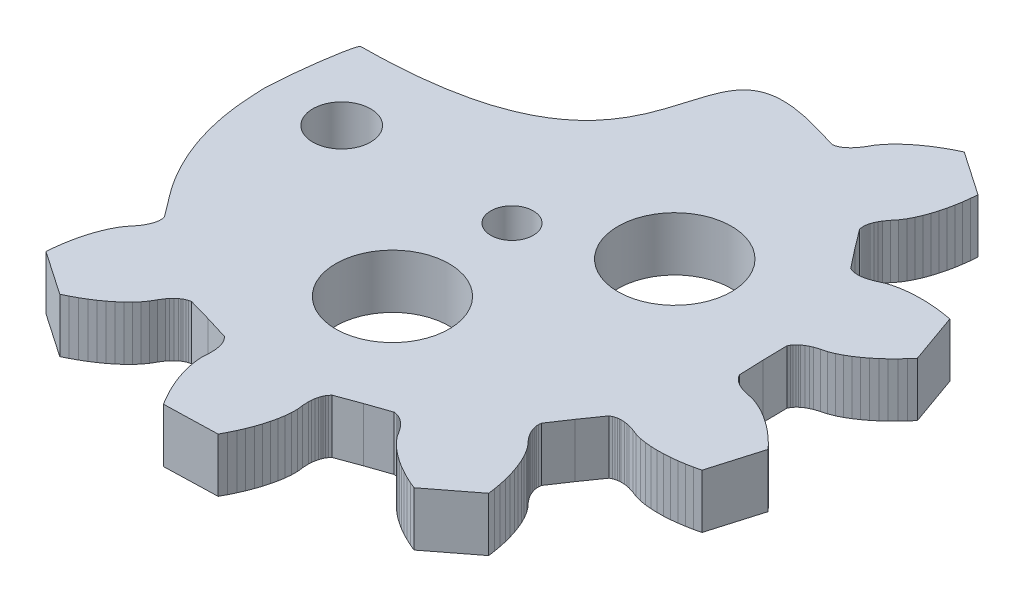
from build123d import *

# Parameters (mm, degrees)
SKETCH1_R           = 1.700000029
SKETCH1_R_2         = 3.33313127
SKETCH1_R_3         = 1.25
SKETCH1_R_4         = 3.337393761
BOSS_EXTRUDE1_DEPTH = 3.175


with BuildPart() as part:
    # Sketch1 → Boss-Extrude1 (new body)
    with BuildSketch(Plane(origin=(0, 0, 0), x_dir=(1, 0, 0), z_dir=(0, 1, 0))):
        with BuildLine():
            Line((11.914200973, 1.674742522), (11.889170094, 3.102731375))
            Line((11.889170094, 3.102731375), (11.9570847, 3.237670669))
            Line((11.9570847, 3.237670669), (12.028696835, 3.33919311))
            Line((12.028696835, 3.33919311), (12.102655529, 3.422833079))
            Line((12.102655529, 3.422833079), (12.178035724, 3.494286875))
            Line((12.178035724, 3.494286875), (12.254270446, 3.556913579))
            Line((12.254270446, 3.556913579), (12.409653424, 3.662914792))
            Line((12.409653424, 3.662914792), (12.567882114, 3.749402911))
            Line((12.567882114, 3.749402911), (12.728386832, 3.820650162))
            Line((12.728386832, 3.820650162), (13.055155513, 3.928510282))
            Line((13.055155513, 3.928510282), (13.385339592, 4.013509101))
            Line((13.385339592, 4.013509101), (13.708266968, 4.141175827))
            Line((13.708266968, 4.141175827), (14.025152969, 4.300117856))
            Line((14.025152969, 4.300117856), (14.336561854, 4.484486697))
            Line((14.336561854, 4.484486697), (14.642778466, 4.690879788))
            Line((14.642778466, 4.690879788), (14.943591207, 4.91743822))
            Line((14.943591207, 4.91743822), (15.23864199, 5.162585728))
            Line((15.23864199, 5.162585728), (15.528147838, 5.425963575))
            Line((15.528147838, 5.425963575), (15.811180978, 5.706017235))
            Line((15.811180978, 5.706017235), (16.087958432, 6.00288803))
            Line((16.087958432, 6.00288803), (16.357834558, 6.315717165))
            Line((16.357834558, 6.315717165), (15.309046935, 9.268597221))
            Line((15.309046935, 9.268597221), (14.902842443, 9.340333659))
            Line((14.902842443, 9.340333659), (14.500905165, 9.395263833))
            Line((14.500905165, 9.395263833), (14.104800377, 9.433376873))
            Line((14.104800377, 9.433376873), (13.714525367, 9.454401008))
            Line((13.714525367, 9.454401008), (13.330866843, 9.457673121))
            Line((13.330866843, 9.457673121), (12.954956036, 9.442714894))
            Line((12.954956036, 9.442714894), (12.587438591, 9.408939305))
            Line((12.587438591, 9.408939305), (12.229665474, 9.354867924))
            Line((12.229665474, 9.354867924), (11.883695691, 9.277717826))
            Line((11.883695691, 9.277717826), (11.553156237, 9.172488441))
            Line((11.553156237, 9.172488441), (11.24331263, 9.02908079))
            Line((11.24331263, 9.02908079), (10.922162129, 8.906110252))
            Line((10.922162129, 8.906110252), (10.752623832, 8.859876721))
            Line((10.752623832, 8.859876721), (10.57562266, 8.82674251))
            Line((10.57562266, 8.82674251), (10.388378007, 8.810577624))
            Line((10.388378007, 8.810577624), (10.289602743, 8.810784169))
            Line((10.289602743, 8.810784169), (10.186202178, 8.818698115))
            Line((10.186202178, 8.818698115), (10.076331618, 8.836863229))
            Line((10.076331618, 8.836863229), (9.956572951, 8.869986569))
            Line((9.956572951, 8.869986569), (9.81889633, 8.931547934))
            Line((9.81889633, 8.931547934), (8.937794171, 10.054404181))
            Line((8.937794171, 10.054404181), (8.079446863, 11.195218997))
            Line((8.079446863, 11.195218997), (8.055482109, 11.344681686))
            Line((8.055482109, 11.344681686), (8.053846299, 11.468858883))
            Line((8.053846299, 11.468858883), (8.064727285, 11.579925891))
            Line((8.064727285, 11.579925891), (8.083499766, 11.681872293))
            Line((8.083499766, 11.681872293), (8.108674424, 11.777839754))
            Line((8.108674424, 11.777839754), (8.171966442, 11.954946898))
            Line((8.171966442, 11.954946898), (8.249411067, 12.118095929))
            Line((8.249411067, 12.118095929), (8.337308058, 12.270200222))
            Line((8.337308058, 12.270200222), (8.538488295, 12.549895146))
            Line((8.538488295, 12.549895146), (8.755741791, 12.813218639))
            Line((8.755741791, 12.813218639), (8.942202449, 13.10666513))
            Line((8.942202449, 13.10666513), (9.105124259, 13.421918455))
            Line((9.105124259, 13.421918455), (9.248847681, 13.75433678))
            Line((9.248847681, 13.75433678), (9.375429005, 14.101637236))
            Line((9.375429005, 14.101637236), (9.485869251, 14.461917432))
            Line((9.485869251, 14.461917432), (9.580808635, 14.834307704))
            Line((9.580808635, 14.834307704), (9.66066764, 15.217590522))
            Line((9.66066764, 15.217590522), (9.725169562, 15.610994059))
            Line((9.725169562, 15.610994059), (9.774949191, 16.014083482))
            Line((9.774949191, 16.014083482), (9.809653867, 16.426086965))
            Line((9.809653867, 16.426086965), (7.228782167, 18.19739756))
            Line((7.228782167, 18.19739756), (6.857849324, 18.016224736))
            Line((6.857849324, 18.016224736), (6.50064318, 17.823941949))
            Line((6.50064318, 17.823941949), (6.157730707, 17.62161454))
            Line((6.157730707, 17.62161454), (5.829754835, 17.408525034))
            Line((5.829754835, 17.408525034), (5.517561955, 17.185608321))
            Line((5.517561955, 17.185608321), (5.221800422, 16.952146927))
            Line((5.221800422, 16.952146927), (4.944455995, 16.708423495))
            Line((4.944455995, 16.708423495), (4.687020708, 16.453937966))
            Line((4.687020708, 16.453937966), (4.452345698, 16.187777194))
            Line((4.452345698, 16.187777194), (4.246328563, 15.907864854))
            Line((4.246328563, 15.907864854), (4.0800646, 15.609569984))
            Line((4.0800646, 15.609569984), (3.892394039, 15.321037096))
            Line((3.892394039, 15.321037096), (3.782520766, 15.183684484))
            Line((3.782520766, 15.183684484), (3.658711909, 15.052593455))
            Line((3.658711909, 15.052593455), (3.516412701, 14.929198955))
            Line((3.516412701, 14.929198955), (3.436409918, 14.87127931))
            Line((3.436409918, 14.87127931), (3.348298617, 14.816773097))
            Line((3.348298617, 14.816773097), (3.248739357, 14.766691301))
            Line((3.248739357, 14.766691301), (3.132610399, 14.723023281))
            Line((3.132610399, 14.723023281), (2.985048385, 14.691747977))
            Line((2.985048385, 14.691747977), (1.613045831, 15.081520665))
            add(Edge.make_bspline(
                [(1.613045831, 15.081520665), (-7.729706306, 17.786187647), (2.333928114, 5.898093477), (-15.890831097, 5.824780774)],
                knots=[86, 86, 86, 86, 87, 87, 87, 87], degree=3))
            add(Edge.make_bspline(
                [(-15.890831097, 5.824780774), (-16.087958431, 5.803984925), (-16.532063261, 2.803447263), (-16.607446169, 0.877037468)],
                knots=[87, 87, 87, 87, 88, 88, 88, 88], degree=3))
            Line((-16.607446169, 0.877037468), (-16.567551933, 0.129626189))
            add(Edge.make_bspline(
                [(-16.567551933, 0.129626189), (-16.408040095, -3.82164484), (-14.671010433, -6.429208362), (-13.830225705, -7.50220023)],
                knots=[89, 89, 89, 89, 90, 90, 90, 90], degree=3))
            Line((-13.830225705, -7.50220023), (-12.971878397, -8.643009611))
            Line((-12.971878397, -8.643009611), (-12.947913643, -8.792195093))
            Line((-12.947913643, -8.792195093), (-12.946492143, -8.916654932))
            Line((-12.946492143, -8.916654932), (-12.956947221, -9.027509959))
            Line((-12.956947221, -9.027509959), (-12.976148323, -9.129668342))
            Line((-12.976148323, -9.129668342), (-13.001111383, -9.225635803))
            Line((-13.001111383, -9.225635803), (-13.064400689, -9.402742946))
            Line((-13.064400689, -9.402742946), (-13.141986379, -9.565891977))
            Line((-13.141986379, -9.565891977), (-13.229880657, -9.718137591))
            Line((-13.229880657, -9.718137591), (-13.430708232, -9.99762597))
            Line((-13.430708232, -9.99762597), (-13.648176038, -10.261009252))
            Line((-13.648176038, -10.261009252), (-13.834425098, -10.554243763))
            Line((-13.834425098, -10.554243763), (-13.997344196, -10.869638408))
            Line((-13.997344196, -10.869638408), (-14.141279215, -11.202056733))
            Line((-14.141279215, -11.202056733), (-14.267863252, -11.549221304))
            Line((-14.267863252, -11.549221304), (-14.378306211, -11.90971348))
            Line((-14.378306211, -11.90971348), (-14.473242882, -12.281886336))
            Line((-14.473242882, -12.281886336), (-14.55289029, -12.665169155))
            Line((-14.55289029, -12.665169155), (-14.617601096, -13.058790108))
            Line((-14.617601096, -13.058790108), (-14.667169128, -13.461879531))
            Line((-14.667169128, -13.461879531), (-14.702299712, -13.873877579))
            Line((-14.702299712, -13.873877579), (-12.121213701, -15.645117513))
            Line((-12.121213701, -15.645117513), (-11.750283571, -15.463808804))
            Line((-11.750283571, -15.463808804), (-11.393080139, -15.271737998))
            Line((-11.393080139, -15.271737998), (-11.050167666, -15.069193172))
            Line((-11.050167666, -15.069193172), (-10.722186369, -14.856533063))
            Line((-10.722186369, -14.856533063), (-10.409781892, -14.633398934))
            Line((-10.409781892, -14.633398934), (-10.114446266, -14.399937541))
            Line((-10.114446266, -14.399937541), (-9.836890242, -14.156214108))
            Line((-9.836890242, -14.156214108), (-9.579457668, -13.901734015))
            Line((-9.579457668, -13.901734015), (-9.344568348, -13.635785223))
            Line((-9.344568348, -13.635785223), (-9.13897712, -13.355443486))
            Line((-9.13897712, -13.355443486), (-8.972281824, -13.057366032))
            Line((-8.972281824, -13.057366032), (-8.784828286, -12.768827709))
            Line((-8.784828286, -12.768827709), (-8.674955013, -12.631475097))
            Line((-8.674955013, -12.631475097), (-8.550931846, -12.500384068))
            Line((-8.550931846, -12.500384068), (-8.409058545, -12.376995004))
            Line((-8.409058545, -12.376995004), (-8.328841452, -12.319075358))
            Line((-8.328841452, -12.319075358), (-8.240518554, -12.264503921))
            Line((-8.240518554, -12.264503921), (-8.141170891, -12.21441669))
            Line((-8.141170891, -12.21441669), (-8.024830336, -12.17103131))
            Line((-8.024830336, -12.17103131), (-7.877482631, -12.13953859))
            Line((-7.877482631, -12.13953859), (-6.505480077, -12.529099297))
            Line((-6.505480077, -12.529099297), (-5.141794926, -12.946934967))
            Line((-5.141794926, -12.946934967), (-5.034911144, -13.053159031))
            Line((-5.034911144, -13.053159031), (-4.960597074, -13.152898661))
            Line((-4.960597074, -13.152898661), (-4.904133139, -13.249007442))
            Line((-4.904133139, -13.249007442), (-4.859545782, -13.342904014))
            Line((-4.859545782, -13.342904014), (-4.823487426, -13.43523519))
            Line((-4.823487426, -13.43523519), (-4.771076393, -13.615766637))
            Line((-4.771076393, -13.615766637), (-4.738007527, -13.793444498))
            Line((-4.738007527, -13.793444498), (-4.719875263, -13.968344869))
            Line((-4.719875263, -13.968344869), (-4.718453763, -14.312661289))
            Line((-4.718453763, -14.312661289), (-4.739857648, -14.653776257))
            Line((-4.739857648, -14.653776257), (-4.718453763, -15.000728847))
            Line((-4.718453763, -15.000728847), (-4.665261448, -15.351883003))
            Line((-4.665261448, -15.351883003), (-4.586606921, -15.705532009))
            Line((-4.586606921, -15.705532009), (-4.485197541, -16.060963826))
            Line((-4.485197541, -16.060963826), (-4.363236092, -16.417607738))
            Line((-4.363236092, -16.417607738), (-4.221579813, -16.774816932))
            Line((-4.221579813, -16.774816932), (-4.061075095, -17.131890241))
            Line((-4.061075095, -17.131890241), (-3.882508646, -17.488316737))
            Line((-3.882508646, -17.488316737), (-3.686162595, -17.843531139))
            Line((-3.686162595, -17.843531139), (-3.472677159, -18.19739756))
            Line((-3.472677159, -18.19739756), (-0.345292944, -18.110550705))
            Line((-0.345292944, -18.110550705), (-0.151792605, -17.745644981))
            Line((-0.151792605, -17.745644981), (0.024571062, -17.3798859))
            Line((0.024571062, -17.3798859), (0.183225659, -17.013980062))
            Line((0.183225659, -17.013980062), (0.323747993, -16.648644942))
            Line((0.323747993, -16.648644942), (0.445495132, -16.284309936))
            Line((0.445495132, -16.284309936), (0.547685794, -15.921399005))
            Line((0.547685794, -15.921399005), (0.628969012, -15.560912264))
            Line((0.628969012, -15.560912264), (0.688208128, -15.203273673))
            Line((0.688208128, -15.203273673), (0.721843966, -14.849907308))
            Line((0.721843966, -14.849907308), (0.724119994, -14.502095925))
            Line((0.724119994, -14.502095925), (0.683797138, -14.162839864))
            Line((0.683797138, -14.162839864), (0.666231846, -13.818952841))
            Line((0.666231846, -13.818952841), (0.674695739, -13.643052356))
            Line((0.674695739, -13.643052356), (0.697879212, -13.46409174))
            Line((0.697879212, -13.46409174), (0.74019054, -13.280494727))
            Line((0.74019054, -13.280494727), (0.771268221, -13.186598154))
            Line((0.771268221, -13.186598154), (0.810595485, -13.090489374))
            Line((0.810595485, -13.090489374), (0.861582305, -12.991320461))
            Line((0.861582305, -12.991320461), (0.930137129, -12.887732567))
            Line((0.930137129, -12.887732567), (1.031117888, -12.775453465))
            Line((1.031117888, -12.775453465), (2.369628382, -12.283092997))
            Line((2.369628382, -12.283092997), (3.717807246, -11.817806266))
            Line((3.717807246, -11.817806266), (3.866793473, -11.84103174))
            Line((3.866793473, -11.84103174), (3.985268992, -11.8777968))
            Line((3.985268992, -11.8777968), (4.087530187, -11.922464935))
            Line((4.087530187, -11.922464935), (4.178628266, -11.972122769))
            Line((4.178628266, -11.972122769), (4.261902669, -12.025411451))
            Line((4.261902669, -12.025411451), (4.410460275, -12.140750685))
            Line((4.410460275, -12.140750685), (4.54123828, -12.264927883))
            Line((4.54123828, -12.264927883), (4.658577142, -12.395801496))
            Line((4.658577142, -12.395801496), (4.861962874, -12.673507062))
            Line((4.861962874, -12.673507062), (5.044582226, -12.961827969))
            Line((5.044582226, -12.961827969), (5.265535962, -13.230271611))
            Line((5.265535962, -13.230271611), (5.514504644, -13.482898232))
            Line((5.514504644, -13.482898232), (5.785804982, -13.722632079))
            Line((5.785804982, -13.722632079), (6.076306423, -13.950609152))
            Line((6.076306423, -13.950609152), (6.384373155, -14.167258846))
            Line((6.384373155, -14.167258846), (6.708510433, -14.372651823))
            Line((6.708510433, -14.372651823), (7.047725378, -14.567141383))
            Line((7.047725378, -14.567141383), (7.401304527, -14.750309))
            Line((7.401304527, -14.750309), (7.768393352, -14.922361219))
            Line((7.768393352, -14.922361219), (8.148782969, -15.082727324))
            Line((8.148782969, -15.082727324), (10.627889914, -13.171069211))
            Line((10.627889914, -13.171069211), (10.570430386, -12.761489917))
            Line((10.570430386, -12.761489917), (10.498462877, -12.361890022))
            Line((10.498462877, -12.361890022), (10.412345474, -11.97247607))
            Line((10.412345474, -11.97247607), (10.311576312, -11.594248176))
            Line((10.311576312, -11.594248176), (10.196087571, -11.227700961))
            Line((10.196087571, -11.227700961), (10.065876538, -10.874122616))
            Line((10.065876538, -10.874122616), (9.920305709, -10.534225178))
            Line((9.920305709, -10.534225178), (9.758450024, -10.210498061))
            Line((9.758450024, -10.210498061), (9.578247764, -9.904582757))
            Line((9.578247764, -9.904582757), (9.375998689, -9.622028812))
            Line((9.375998689, -9.622028812), (9.14438099, -9.371185002))
            Line((9.14438099, -9.371185002), (8.928123087, -9.103241418))
            Line((8.928123087, -9.103241418), (8.831976512, -8.956192048))
            Line((8.831976512, -8.956192048), (8.745856396, -8.797679415))
            Line((8.745856396, -8.797679415), (8.672537919, -8.62420312))
            Line((8.672537919, -8.62420312), (8.642244234, -8.529877151))
            Line((8.642244234, -8.529877151), (8.617850859, -8.429137408))
            Line((8.617850859, -8.429137408), (8.600925785, -8.318641117))
            Line((8.600925785, -8.318641117), (8.595521915, -8.194681336))
            Line((8.595521915, -8.194681336), (8.611451396, -8.044430514))
            Line((8.611451396, -8.044430514), (9.405296782, -6.857594148))
            Line((9.405296782, -6.857594148), (10.223109636, -5.687498821))
            Line((10.223109636, -5.687498821), (10.357373571, -5.618393118))
            Line((10.357373571, -5.618393118), (10.474639187, -5.578638587))
            Line((10.474639187, -5.578638587), (10.583516868, -5.554418435))
            Line((10.583516868, -5.554418435), (10.686347748, -5.540878848))
            Line((10.686347748, -5.540878848), (10.784911415, -5.535182547))
            Line((10.784911415, -5.535182547), (10.972793573, -5.540878848))
            Line((10.972793573, -5.540878848), (11.151574332, -5.564104321))
            Line((11.151574332, -5.564104321), (11.323315412, -5.601010702))
            Line((11.323315412, -5.601010702), (11.65072431, -5.706022672))
            Line((11.65072431, -5.706022672), (11.967965686, -5.831694605))
            Line((11.967965686, -5.831694605), (12.304050076, -5.918682781))
            Line((12.304050076, -5.918682781), (12.653787919, -5.976249125))
            Line((12.653787919, -5.976249125), (13.013839776, -6.010796541))
            Line((13.013839776, -6.010796541), (13.382493879, -6.024124147))
            Line((13.382493879, -6.024124147), (13.758686815, -6.018063674))
            Line((13.758686815, -6.018063674), (14.141493524, -5.993414125))
            Line((14.141493524, -5.993414125), (14.530132724, -5.950811443))
            Line((14.530132724, -5.950811443), (14.92382042, -5.890826345))
            Line((14.92382042, -5.890826345), (15.321704795, -5.813670811))
            Line((15.321704795, -5.813670811), (15.723498296, -5.719556823))
            Line((15.723498296, -5.719556823), (16.607446169, -2.712964123))
            Line((16.607446169, -2.712964123), (16.320786034, -2.415881348))
            Line((16.320786034, -2.415881348), (16.028079098, -2.134827573))
            Line((16.028079098, -2.134827573), (15.729971005, -1.870444177))
            Line((15.729971005, -1.870444177), (15.426383083, -1.623872594))
            Line((15.426383083, -1.623872594), (15.117960976, -1.395254144))
            Line((15.117960976, -1.395254144), (14.805060058, -1.185871583))
            Line((14.805060058, -1.185871583), (14.48796246, -0.996795683))
            Line((14.48796246, -0.996795683), (14.167096802, -0.830015804))
            Line((14.167096802, -0.830015804), (13.841679089, -0.688668171))
            Line((13.841679089, -0.688668171), (13.512349537, -0.579166559))
            Line((13.512349537, -0.579166559), (13.177898245, -0.512555706))
            Line((13.177898245, -0.512555706), (12.845866758, -0.423078115))
            Line((12.845866758, -0.423078115), (12.68159398, -0.360880809))
            Line((12.68159398, -0.360880809), (12.518742701, -0.283154558))
            Line((12.518742701, -0.283154558), (12.357882609, -0.185980438))
            Line((12.357882609, -0.185980438), (12.278020891, -0.127631396))
            Line((12.278020891, -0.127631396), (12.199013701, -0.060379165))
            Line((12.199013701, -0.060379165), (12.120576196, 0.018988577))
            Line((12.120576196, 0.018988577), (12.043416413, 0.116304017))
            Line((12.043416413, 0.116304017), (11.967965686, 0.246965649))
            Line((11.967965686, 0.246965649), (11.914200973, 1.674742522))
        make_face()
        with Locations((-12.428320106, 1.242190502)):
            Circle(SKETCH1_R, mode=Mode.SUBTRACT)
        with Locations((-2.231630297, -5.96997667)):
            Circle(SKETCH1_R_2, mode=Mode.SUBTRACT)
        with Locations((-2.44621848, 1.276210684)):
            Circle(SKETCH1_R_3, mode=Mode.SUBTRACT)
        with Locations((4.168032123, 4.234140228)):
            Circle(SKETCH1_R_4, mode=Mode.SUBTRACT)
    extrude(amount=BOSS_EXTRUDE1_DEPTH)


solid = part.part
